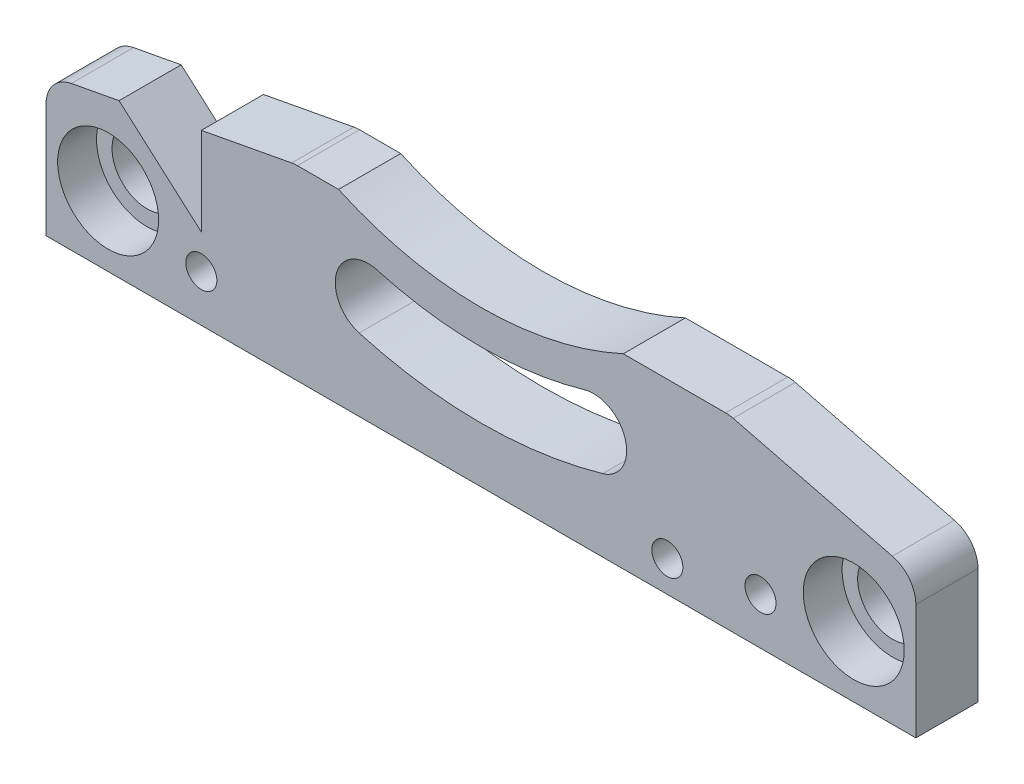
from build123d import *

# Parameters (mm, degrees)
SKETCH1_W          = 88.9
SKETCH1_H          = 19.05
BASE_EXTRUDE_DEPTH = 6.35
CUT_EXTRUDE1_DEPTH = 49.775275499
CUT_EXTRUDE2_DEPTH = 49.775275499
CUT_EXTRUDE3_DEPTH = 49.775275499
CUT_EXTRUDE4_DEPTH = 49.775275499
CUT_EXTRUDE5_DEPTH = 49.775275499
FILLET1_R          = 3.175
HOLE1_D            = 7.14375
HOLE1_CBORE_D      = 10.31875
HOLE1_CBORE_DEPTH  = 3.96875
LPATTERN1_COUNT    = 2
LPATTERN1_PITCH    = 76.2
HOLE2_OUTLINE_R    = 1.5875
HOLE2_DEPTH        = 6.35
HOLE3_OUTLINE_R    = 1.5875
HOLE3_DEPTH        = 6.35
LPATTERN2_COUNT    = 2
LPATTERN2_PITCH    = 57.15


# Read off the part's stored shape, not the designer's step: Hole2, Hole3
with BuildPart() as part:
    # Sketch1 → Base-Extrude (new body)
    with BuildSketch(Plane.XY):
        with Locations((0, 9.525)):
            Rectangle(SKETCH1_W, SKETCH1_H)
    extrude(amount=BASE_EXTRUDE_DEPTH)

    # Sketch2 → Cut-Extrude1 (cut, through all)
    with BuildSketch(Plane.XY.offset(6.35)):
        Polygon((44.45, 14.2875), (25.4, 19.05), (44.45, 19.05), align=None)
    extrude(amount=-CUT_EXTRUDE1_DEPTH, mode=Mode.SUBTRACT)

    # Sketch3 → Cut-Extrude2 (cut, through all)
    with BuildSketch(Plane.XY.offset(6.35)):
        with BuildLine():
            Line((-136.365872597, 74.873193339), (-14.549677831, 19.05))
            ThreePointArc((-14.549677831, 19.05), (0, 15.875), (14.549677831, 19.05))
            Line((14.549677831, 19.05), (136.365872597, 74.873193339))
            Line((136.365872597, 74.873193339), (136.365872597, 342.868821823))
            Line((136.365872597, 342.868821823), (-136.365872597, 342.868821823))
            Line((-136.365872597, 342.868821823), (-136.365872597, 74.873193339))
        make_face()
    extrude(amount=-CUT_EXTRUDE2_DEPTH, mode=Mode.SUBTRACT)

    # Sketch4 → Cut-Extrude3 (cut, through all)
    with BuildSketch(Plane.XY.offset(6.35)):
        Polygon((-231.275885049, -20.742353447), (-44.45, 14.2875), (-19.05, 19.05), (167.775885049, 54.079853447), (97.716178156, 427.731623544), (-301.335591942, 352.909416651), align=None)
    extrude(amount=-CUT_EXTRUDE3_DEPTH, mode=Mode.SUBTRACT)

    # Sketch5 → Cut-Extrude4 (cut, through all)
    with BuildSketch(Plane.XY.offset(6.35)):
        Polygon((-36.984386732, 15.687302488), (-28.575, 8.262261056), (-28.575, 17.2640625), align=None)
    extrude(amount=-CUT_EXTRUDE4_DEPTH, mode=Mode.SUBTRACT)

    # Sketch6 → Cut-Extrude5 (cut, through all)
    with BuildSketch(Plane.XY.offset(6.35)):
        with BuildLine():
            ThreePointArc((-10.587110246, 13.878358811), (0, 12.3904375), (10.587110246, 13.878358811))
            ThreePointArc((10.587110246, 13.878358811), (14.75971189, 11.565447951), (12.446801031, 7.392846306))
            ThreePointArc((12.446801031, 7.392846306), (0, 5.6435625), (-12.446801031, 7.392846306))
            ThreePointArc((-12.446801031, 7.392846306), (-14.75971189, 11.565447951), (-10.587110246, 13.878358811))
        make_face()
    extrude(amount=-CUT_EXTRUDE5_DEPTH, mode=Mode.SUBTRACT)

    # Fillet1
    fillet1_edges = [part.edges().sort_by_distance(p)[0] for p in [
        (44.45, 14.2875, 3.175),
        (25.4, 19.05, 3.175),
        (-19.05, 19.05, 3.175),
        (-44.45, 14.2875, 3.175),
    ]]
    fillet(fillet1_edges, radius=FILLET1_R)

    # Hole1 (through all)
    with Locations(Plane.XY.offset(6.35)):
        with Locations((38.1, 7.14375)):
            hole1 = CounterBoreHole(HOLE1_D / 2, HOLE1_CBORE_D / 2, HOLE1_CBORE_DEPTH)

    # LPattern1: Hole1 ×2
    with Locations(*[(-i * LPATTERN1_PITCH, 0, 0) for i in range(1, LPATTERN1_COUNT)]):
        add(hole1, mode=Mode.SUBTRACT)

    # Hole2 outline → Hole2 (cut)
    with BuildSketch(Plane.XY):
        with Locations((28.575, 4.7625)):
            Circle(HOLE2_OUTLINE_R)
    hole2 = extrude(amount=HOLE2_DEPTH, mode=Mode.SUBTRACT)

    # Hole3 outline → Hole3 (cut)
    with BuildSketch(Plane.XY):
        with Locations((19.05, 3.175)):
            Circle(HOLE3_OUTLINE_R)
    extrude(amount=HOLE3_DEPTH, mode=Mode.SUBTRACT)

    # LPattern2: Hole2 ×2
    with Locations(*[(-i * LPATTERN2_PITCH, 0, 0) for i in range(1, LPATTERN2_COUNT)]):
        add(hole2, mode=Mode.SUBTRACT)


solid = part.part
